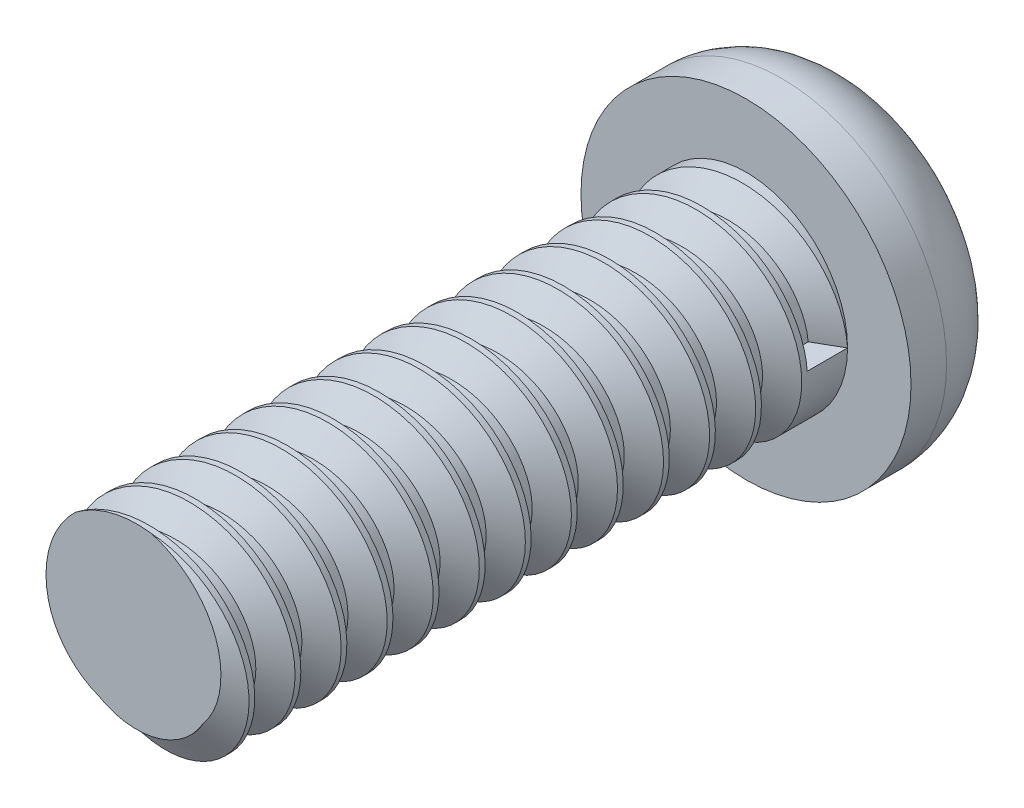
from build123d import *

# Parameters (mm, degrees)
SKETCH_1_R      = 2
EXTRUDE_1_DEPTH = 12
SKETCH_2_R      = 3.25
EXTRUDE_2_DEPTH = 2.2
FILLET_1_R      = 1.5
THREAD_1_PITCH  = 0.907142857


with BuildPart() as part:
    # Sketch 1 → 凸台-拉伸1 (new body)
    with BuildSketch(Plane.XY):
        Circle(SKETCH_1_R)
    extrude(amount=EXTRUDE_1_DEPTH)

    # 草图2 → 凸台-拉伸2 (add)
    with BuildSketch(Plane(origin=(0, 0, 0), x_dir=(-1, 0, 0), z_dir=(0, 0, -1))):
        Circle(SKETCH_2_R)
    extrude(amount=EXTRUDE_2_DEPTH)

    # 圆角1
    fillet_1_edges = [part.edges().sort_by_distance(p)[0] for p in [
        (3.25, 0, -2.2),
    ]]
    fillet(fillet_1_edges, radius=FILLET_1_R)

    # 螺纹线1: the profile of Sketch 1 2 profile screwed along a right-hand helix of 13.228346 turns, 8 arcs to a turn; built about Z, then put on its axis
    thread_1_z = Axis((0, 0, 0), (0, 0, 1))
    thread_1_corners = [(2.0003, 0, -0.000173205), (2.0003, 0, 0.793923203), (1.508994528, 0, 0.510267856), (1.508994528, 0, 0.283482142)]
    with BuildLine(mode=Mode.PRIVATE) as thread_1_profile:
        Line(thread_1_corners[0], thread_1_corners[1])
        Line(thread_1_corners[1], thread_1_corners[2])
        Line(thread_1_corners[2], thread_1_corners[3])
        Line(thread_1_corners[3], thread_1_corners[0])
    thread_1_cap = Face(thread_1_profile.wire())
    thread_1_turn_angles = [0, 22.5, 45, 67.5, 90, 112.5, 135, 157.5, 180, 202.5, 225, 247.5, 270, 292.5, 315, 337.5, 360]
    thread_1_turn_weights = [1, 0.9238795325112867, 1, 0.9238795325112867, 1, 0.9238795325112867, 1, 0.9238795325112867, 1, 0.9238795325112867, 1, 0.9238795325112867, 1, 0.9238795325112867, 1, 0.9238795325112867, 1]
    thread_1_turn_rails = [Edge.make_bspline([Vector(p[0], p[1], 0).rotate(thread_1_z, thread_1_turn_angles[k]) / thread_1_turn_weights[k] + Vector(0, 0, p[2] + THREAD_1_PITCH * thread_1_turn_angles[k] / 360) for k in range(17)], [0, 0, 0, 1, 1, 2, 2, 3, 3, 4, 4, 5, 5, 6, 6, 7, 7, 8, 8, 8], 2, thread_1_turn_weights) for p in thread_1_corners]
    thread_1_turn_sides = [Face.make_surface_from_curves(thread_1_turn_rails[p[0]], thread_1_turn_rails[p[1]]) for p in [(0, 1), (1, 2), (2, 3), (3, 0)]]
    thread_1_last_angles = [4680, 4702.5, 4725, 4743.602362205, 4762.204724409]
    thread_1_last_weights = [1, 0.9238795325112867, 1, 0.9477552590699362, 1]
    thread_1_last_rails = [Edge.make_bspline([Vector(p[0], p[1], 0).rotate(thread_1_z, thread_1_last_angles[k]) / thread_1_last_weights[k] + Vector(0, 0, p[2] + THREAD_1_PITCH * thread_1_last_angles[k] / 360) for k in range(5)], [0, 0, 0, 1, 1, 2, 2, 2], 2, thread_1_last_weights) for p in thread_1_corners]
    thread_1_last_sides = [Face.make_surface_from_curves(thread_1_last_rails[p[0]], thread_1_last_rails[p[1]]) for p in [(0, 1), (1, 2), (2, 3), (3, 0)]]
    thread_1 = Plane(origin=(0, 0, 0), x_dir=(1, 0, 0), z_dir=(0, 0, 1)) * Solid(Shell([*[p.moved(Location((0, 0, THREAD_1_PITCH * i))) for i in range(13) for p in thread_1_turn_sides], *thread_1_last_sides, thread_1_cap, thread_1_cap.rotate(thread_1_z, 4762.204724409).moved(Location((0, 0, THREAD_1_PITCH * 4762.204724409 / 360)))]))
    add(thread_1, mode=Mode.SUBTRACT)


solid = part.part
